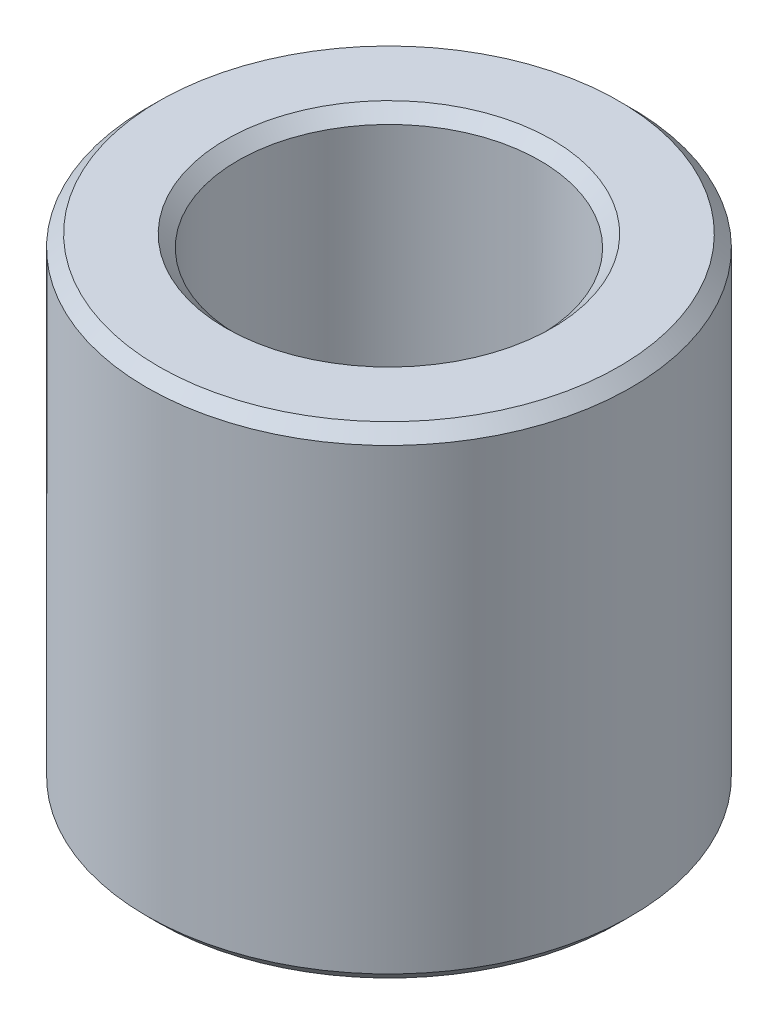
from build123d import *

# Parameters (mm, degrees)
SKETCH1_R           = 57.5
BOSS_EXTRUDE1_DEPTH = 114.416073104
SKETCH2_R           = 35.881153716
CUT_EXTRUDE1_DEPTH  = 141.369290746
CHAMFER1_SIZE       = 2.867565058


with BuildPart() as part:
    # Sketch1 → Boss-Extrude1 (new body)
    with BuildSketch(Plane(origin=(0, 0, 0), x_dir=(1, 0, 0), z_dir=(0, 1, 0))):
        Circle(SKETCH1_R)
    extrude(amount=BOSS_EXTRUDE1_DEPTH)

    # Sketch2 → Cut-Extrude1 (cut, through all)
    with BuildSketch(Plane(origin=(0, 0, 0), x_dir=(1, 0, 0), z_dir=(0, 1, 0))):
        Circle(SKETCH2_R)
    extrude(amount=CUT_EXTRUDE1_DEPTH, mode=Mode.SUBTRACT)

    # Chamfer1
    chamfer1_edges = [part.edges().sort_by_distance(p)[0] for p in [
        (-35.881153716, 114.416073104, 0),
        (-35.881153716, 0, 0),
        (-57.5, 0, 0),
        (-57.5, 114.416073104, 0),
    ]]
    chamfer(chamfer1_edges, length=CHAMFER1_SIZE)


solid = part.part
